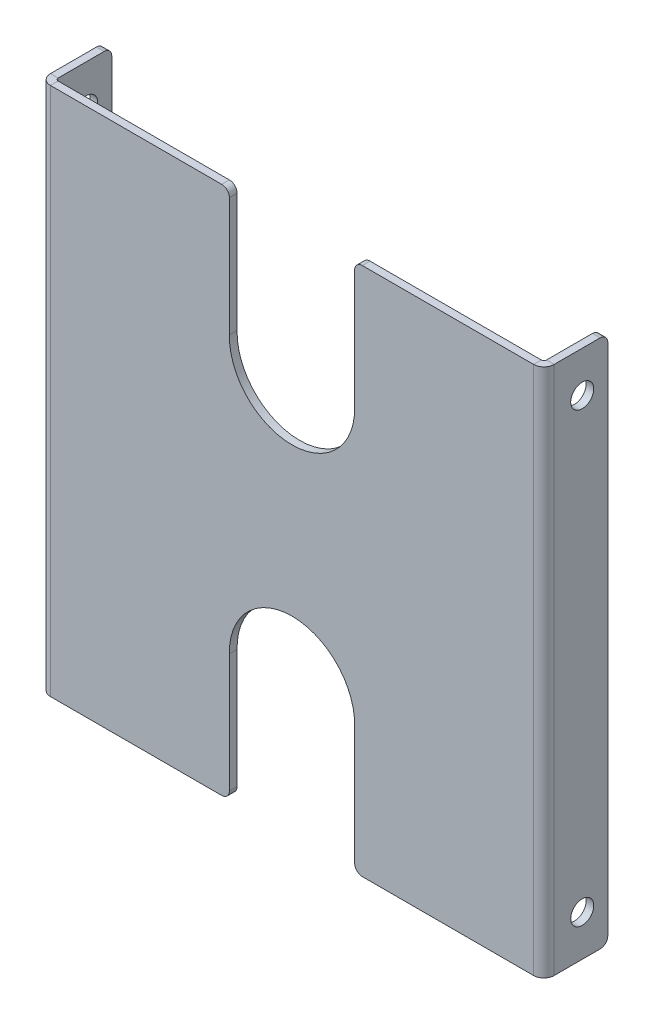
from build123d import *

# Parameters (mm, degrees)
BASE_FLANGE1_START = -103.5
BASE_FLANGE1_DEPTH = 207
CUT_EXTRUDE1_REACH = 225.934
SKETCH6_R          = 4.5
CUT_EXTRUDE2_REACH = 147.05
FILLET1_R          = 3
FILLET2_R          = 3


# Read off the part's stored shape, not the designer's step: Base-Flange1
with BuildPart() as part:
    # Base-Flange1 outline → Base-Flange1 (new body)
    with BuildSketch(Plane(origin=(0, 0, 0), x_dir=(1, 0, 0), z_dir=(0, 1, 0)).offset(BASE_FLANGE1_START)):
        with BuildLine():
            Line((-95.5, 4), (-95.5, 25))
            Line((-95.5, 25), (-98.5, 25))
            Line((-98.5, 25), (-98.5, 4))
            ThreePointArc((-98.5, 4), (-97.328427125, 1.171572875), (-94.5, 0))
            Line((-94.5, 0), (94.5, 0))
            ThreePointArc((94.5, 0), (97.328427125, 1.171572875), (98.5, 4))
            Line((98.5, 4), (98.5, 25))
            Line((98.5, 25), (95.5, 25))
            Line((95.5, 25), (95.5, 4))
            ThreePointArc((95.5, 4), (95.207106781, 3.292893219), (94.5, 3))
            Line((94.5, 3), (-94.5, 3))
            ThreePointArc((-94.5, 3), (-95.207106781, 3.292893219), (-95.5, 4))
        make_face()
    extrude(amount=BASE_FLANGE1_DEPTH)

    # Cut-Extrude1: up to this face of the body (flat: up to its plane)
    cut_extrude1_end = Plane(part.part.faces().sort_by_distance((-98.5, 0, -14.5))[0])
    # Sketch6 → Cut-Extrude1 (cut, up to the picked face)
    with BuildSketch(Plane(origin=(98.5, 0, 0), x_dir=(0, 0, -1), z_dir=(1, 0, 0)), mode=Mode.PRIVATE) as cut_extrude1_sk1:
        with Locations((15, 87.5)):
            Circle(SKETCH6_R)
    cut_extrude1_tool1 = split(extrude(cut_extrude1_sk1.sketch, amount=-CUT_EXTRUDE1_REACH, mode=Mode.PRIVATE), bisect_by=cut_extrude1_end, keep=Keep.BOTH, mode=Mode.PRIVATE)
    # Sketch6 → Cut-Extrude1 (cut, up to the picked face)
    with BuildSketch(Plane(origin=(98.5, 0, 0), x_dir=(0, 0, -1), z_dir=(1, 0, 0)), mode=Mode.PRIVATE) as cut_extrude1_sk2:
        with Locations((15, -87.5)):
            Circle(SKETCH6_R)
    cut_extrude1_tool2 = split(extrude(cut_extrude1_sk2.sketch, amount=-CUT_EXTRUDE1_REACH, mode=Mode.PRIVATE), bisect_by=cut_extrude1_end, keep=Keep.BOTH, mode=Mode.PRIVATE)
    add(cut_extrude1_tool1.solids().sort_by(Axis((98.5, 87.5, -15), (-1, 0, 0)))[0], mode=Mode.SUBTRACT)
    add(cut_extrude1_tool2.solids().sort_by(Axis((98.5, -87.5, -15), (-1, 0, 0)))[0], mode=Mode.SUBTRACT)

    # Sketch7 → Cut-Extrude2 (cut, up to next)
    with BuildSketch(Plane.XY, mode=Mode.PRIVATE) as cut_extrude2_sk1:
        with BuildLine():
            Line((24.494899552, 103.5), (24.494899552, 53.999895909))
            ThreePointArc((24.494899552, 53.999895909), (0, 29), (-24.494899552, 53.999895909))
            Line((-24.494899552, 53.999895909), (-24.494899552, 103.5))
            Line((-24.494899552, 103.5), (24.494899552, 103.5))
        make_face()
    cut_extrude2_tool1 = extrude(cut_extrude2_sk1.sketch, amount=-CUT_EXTRUDE2_REACH, mode=Mode.PRIVATE) & part.part
    # Sketch7 → Cut-Extrude2 (cut, up to next)
    with BuildSketch(Plane.XY, mode=Mode.PRIVATE) as cut_extrude2_sk2:
        with BuildLine():
            Line((24.494899552, -103.5), (24.494899552, -53.999895909))
            ThreePointArc((24.494899552, -53.999895909), (0, -29), (-24.494899552, -53.999895909))
            Line((-24.494899552, -53.999895909), (-24.494899552, -103.5))
            Line((-24.494899552, -103.5), (24.494899552, -103.5))
        make_face()
    cut_extrude2_tool2 = extrude(cut_extrude2_sk2.sketch, amount=-CUT_EXTRUDE2_REACH, mode=Mode.PRIVATE) & part.part
    add(cut_extrude2_tool1.solids().sort_by_distance((0, 68.661453, 0))[0], mode=Mode.SUBTRACT)
    add(cut_extrude2_tool2.solids().sort_by_distance((0, -68.661453, 0))[0], mode=Mode.SUBTRACT)

    # Fillet1
    fillet1_edges = [part.edges().sort_by_distance(p)[0] for p in [
        (97, -103.5, -25),
        (-97, -103.5, -25),
        (97, 103.5, -25),
        (-97, 103.5, -25),
    ]]
    fillet(fillet1_edges, radius=FILLET1_R)

    # Fillet2
    fillet2_edges = [part.edges().sort_by_distance(p)[0] for p in [
        (-24.494899552, 103.5, -1.5),
        (24.494899552, 103.5, -1.5),
        (24.494899552, -103.5, -1.5),
        (-24.494899552, -103.5, -1.5),
    ]]
    fillet(fillet2_edges, radius=FILLET2_R)


solid = part.part
